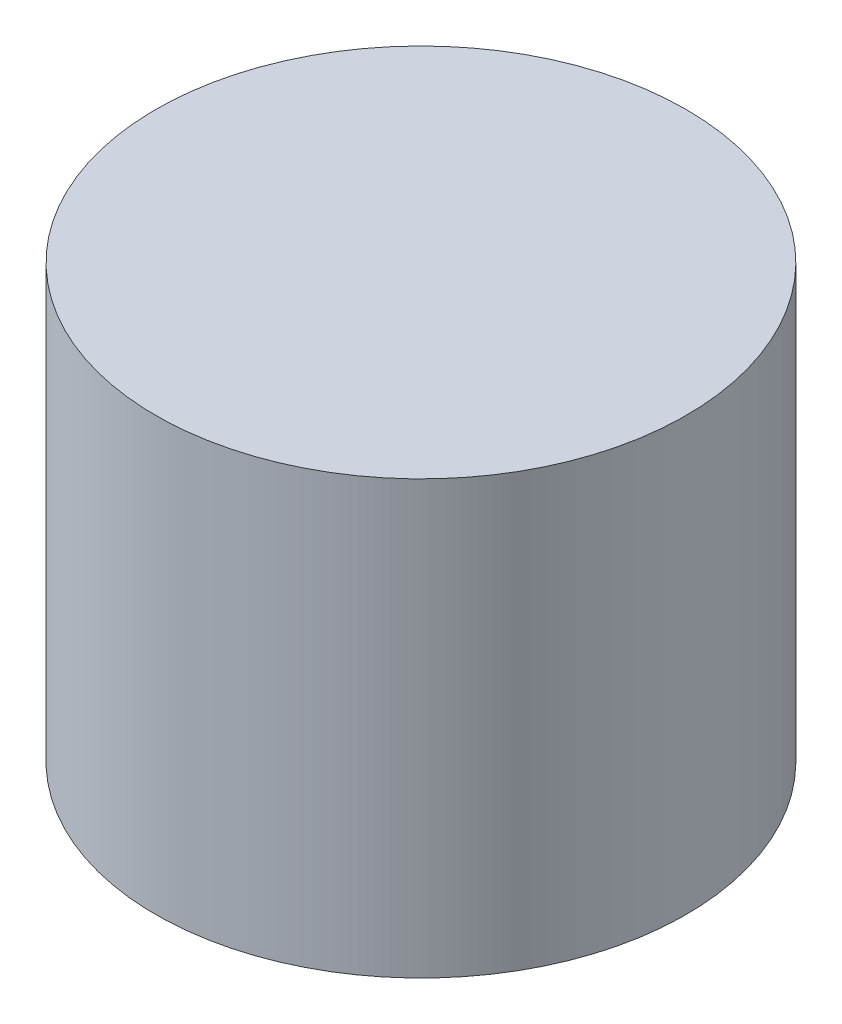
from build123d import *

# Parameters (mm, degrees)
SKETCH1_R           = 37.5
BOSS_EXTRUDE1_DEPTH = 61.15


with BuildPart() as part:
    # Sketch1 → Boss-Extrude1 (new body)
    with BuildSketch(Plane(origin=(0, 0, 0), x_dir=(1, 0, 0), z_dir=(0, 1, 0))):
        Circle(SKETCH1_R)
    extrude(amount=BOSS_EXTRUDE1_DEPTH)


solid = part.part
